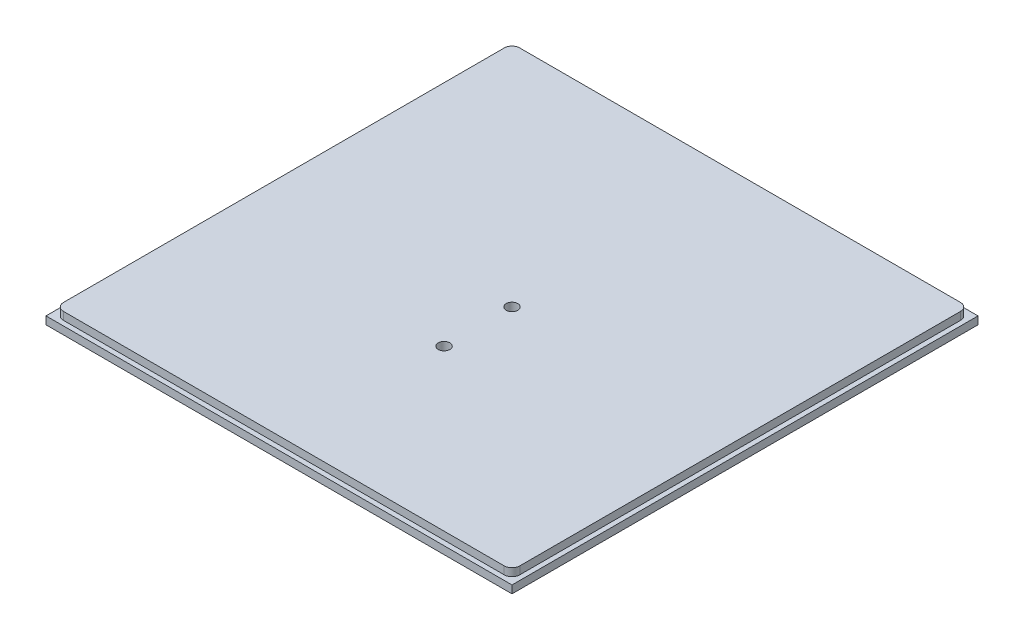
from build123d import *

# Parameters (mm, degrees)
SKETCH1_W           = 120
SKETCH1_H           = 120
BOSS_EXTRUDE1_DEPTH = 2
SKETCH2_W           = 117.5
SKETCH2_H           = 117.5
BOSS_EXTRUDE2_DEPTH = 2
FILLET1_R           = 2
SKETCH4_R           = 1.5
CUT_EXTRUDE1_DEPTH  = 85.947042326


with BuildPart() as part:
    # Sketch1 → Boss-Extrude1 (new body)
    with BuildSketch(Plane(origin=(0, 0, 0), x_dir=(1, 0, 0), z_dir=(0, 1, 0))):
        Rectangle(SKETCH1_W, SKETCH1_H)
    extrude(amount=BOSS_EXTRUDE1_DEPTH)

    # Sketch2 → Boss-Extrude2 (add)
    with BuildSketch(Plane(origin=(0, 2, 0), x_dir=(1, 0, 0), z_dir=(0, 1, 0))):
        Rectangle(SKETCH2_W, SKETCH2_H)
    extrude(amount=BOSS_EXTRUDE2_DEPTH)

    # Fillet1
    fillet1_edges = [part.edges().sort_by_distance(p)[0] for p in [
        (-58.75, 3, -58.75),
        (58.75, 3, -58.75),
        (58.75, 3, 58.75),
        (-58.75, 3, 58.75),
    ]]
    fillet(fillet1_edges, radius=FILLET1_R)

    # Sketch4 → Cut-Extrude1 (cut, through all)
    with BuildSketch(Plane.XZ):
        Circle(SKETCH4_R)
        with Locations((0, 17.5)):
            Circle(SKETCH4_R)
    extrude(amount=-CUT_EXTRUDE1_DEPTH, mode=Mode.SUBTRACT)


solid = part.part
